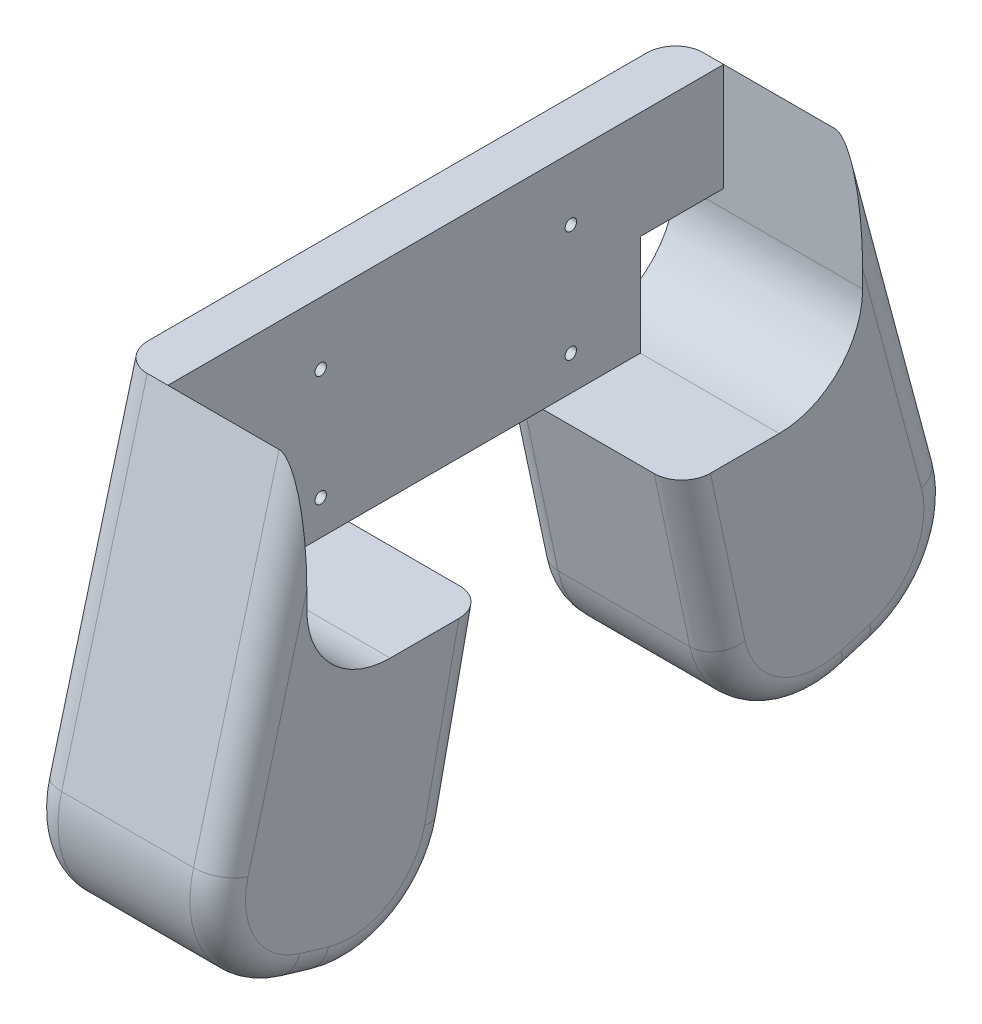
from build123d import *

# Parameters (mm, degrees)
BOSS_EXTRUDE1_DEPTH      = 10
BOSS_EXTRUDE1_DEPTH_BACK = 7.437731252
BOSS_EXTRUDE2_DEPTH      = 50
FILLET7_R                = 10
FILLET9_R                = 10
FILLET10_R               = 10
CUT_EXTRUDE1_DEPTH       = 30
CUT_EXTRUDE1_DEPTH_BACK  = 30
SKETCH5_R                = 2.05
CUT_EXTRUDE2_START       = -30
CUT_EXTRUDE2_DEPTH       = 30


with BuildPart() as part:
    # Sketch2 → Boss-Extrude1 (new, two sides: drawn at the far end of the back side and taken through both)
    with BuildSketch(Plane(origin=(0, 0, 0), x_dir=(0, 0, -1), z_dir=(1, 0, 0)).offset(-BOSS_EXTRUDE1_DEPTH_BACK)):
        with BuildLine():
            Line((100, 0), (130.792862778, -114.920528399))
            ThreePointArc((130.792862778, -114.920528399), (127.318193667, -142.802769687), (105.386466731, -160.366711677))
            Line((105.386466731, -160.366711677), (95.023521596, -163.453246629))
            ThreePointArc((95.023521596, -163.453246629), (65.300089376, -159.771732448), (47.8454422, -135.433054144))
            Line((47.8454422, -135.433054144), (35, -75))
            Line((35, -75), (-35, -75))
            Line((-35, -75), (-47.8454422, -135.433054144))
            ThreePointArc((-47.8454422, -135.433054144), (-65.300089376, -159.771732448), (-95.023521596, -163.453246629))
            Line((-95.023521596, -163.453246629), (-105.386466731, -160.366711677))
            ThreePointArc((-105.386466731, -160.366711677), (-127.318193667, -142.802769687), (-130.792862778, -114.920528399))
            Line((-130.792862778, -114.920528399), (-100, 0))
            Line((-100, 0), (-35, 0))
            Line((-35, 0), (35, 0))
            Line((35, 0), (100, 0))
        make_face()
    extrude(amount=BOSS_EXTRUDE1_DEPTH + BOSS_EXTRUDE1_DEPTH_BACK)

    # Sketch3 → Boss-Extrude2 (add)
    with BuildSketch(Plane(origin=(10, 0, 0), x_dir=(0, 0, -1), z_dir=(1, 0, 0))):
        with BuildLine():
            Line((100, 0), (130.792862778, -114.920528399))
            ThreePointArc((130.792862778, -114.920528399), (127.318193667, -142.802769687), (105.386466731, -160.366711677))
            Line((105.386466731, -160.366711677), (95.023521596, -163.453246629))
            ThreePointArc((95.023521596, -163.453246629), (65.300089376, -159.771732448), (47.8454422, -135.433054144))
            Line((47.8454422, -135.433054144), (35, -75))
            Line((35, -75), (70, -75))
            ThreePointArc((70, -75), (91.213203436, -66.213203436), (100, -45))
            Line((100, -45), (100, 0))
        make_face()
        with BuildLine():
            Line((-35, -75), (-47.8454422, -135.433054144))
            ThreePointArc((-47.8454422, -135.433054144), (-65.300089376, -159.771732448), (-95.023521596, -163.453246629))
            Line((-95.023521596, -163.453246629), (-105.386466731, -160.366711677))
            ThreePointArc((-105.386466731, -160.366711677), (-127.318193667, -142.802769687), (-130.792862778, -114.920528399))
            Line((-130.792862778, -114.920528399), (-100, 0))
            Line((-100, 0), (-100, -45))
            ThreePointArc((-100, -45), (-91.213203436, -66.213203436), (-70, -75))
            Line((-70, -75), (-35, -75))
        make_face()
    extrude(amount=BOSS_EXTRUDE2_DEPTH)

    # Fillet7
    fillet7_edges = [part.edges().sort_by_distance(p)[0] for p in [
        (60, -105.216527072, 41.4227211),
        (60, -159.771732448, 65.300089376),
        (60, -161.909979153, 100.204994164),
        (60, -142.802769687, 127.318193667),
        (60, -57.4602642, 115.396431389),
    ]]
    fillet(fillet7_edges, radius=FILLET7_R)

    # Fillet9
    fillet9_edges = [part.edges().sort_by_distance(p)[0] for p in [
        (60, -57.4602642, -115.396431389),
        (60, -159.771732448, -65.300089376),
        (60, -142.802769687, -127.318193667),
        (60, -161.909979153, -100.204994164),
        (60, -105.216527072, -41.4227211),
    ]]
    fillet(fillet9_edges, radius=FILLET9_R)

    # Fillet10
    fillet10_edges = [part.edges().sort_by_distance(p)[0] for p in [
        (-7.437731252, -57.4602642, -115.396431389),
        (-7.437731252, -142.802769687, -127.318193667),
        (-7.437731252, -161.909979153, -100.204994164),
        (-7.437731252, -159.771732448, -65.300089376),
        (-7.437731252, -105.216527072, -41.4227211),
        (-7.437731252, -57.4602642, 115.396431389),
        (-7.437731252, -142.802769687, 127.318193667),
        (-7.437731252, -161.909979153, 100.204994164),
        (-7.437731252, -159.771732448, 65.300089376),
        (-7.437731252, -105.216527072, 41.4227211),
    ]]
    fillet(fillet10_edges, radius=FILLET10_R)

    # Sketch5 → Cut-Extrude1 (cut, two sides: drawn at the far end of the back side and taken through both)
    with BuildSketch(Plane(origin=(10, 0, 0), x_dir=(0, 0, -1), z_dir=(1, 0, 0)).offset(-CUT_EXTRUDE1_DEPTH_BACK)):
        with Locations((45, -62.5)):
            Circle(SKETCH5_R)
        with Locations((-45, -62.5)):
            Circle(SKETCH5_R)
        with Locations((-45, -22.5)):
            Circle(SKETCH5_R)
        with Locations((45, -22.5)):
            Circle(SKETCH5_R)
    extrude(amount=CUT_EXTRUDE1_DEPTH + CUT_EXTRUDE1_DEPTH_BACK, mode=Mode.SUBTRACT)

    # Sketch7 → Cut-Extrude2 (cut)
    with BuildSketch(Plane(origin=(10, 0, 0), x_dir=(0, 0, -1), z_dir=(1, 0, 0)).offset(CUT_EXTRUDE2_START)):
        with BuildLine():
            Line((-70, -38.637033052), (-100, -38.637033052))
            Line((-100, -38.637033052), (-100, -45.17228394))
            ThreePointArc((-100, -45.17228394), (-91.263664233, -66.263664233), (-70.17228394, -75))
            Line((-70.17228394, -75), (-70, -75))
            Line((-70, -75), (-70, -38.637033052))
        make_face()
        with BuildLine():
            ThreePointArc((70, -75), (91.213203436, -66.213203436), (100, -45))
            Line((100, -45), (100, -38.637033052))
            Line((100, -38.637033052), (70, -38.637033052))
            Line((70, -38.637033052), (70, -75))
        make_face()
    extrude(amount=CUT_EXTRUDE2_DEPTH, mode=Mode.SUBTRACT)


solid = part.part
